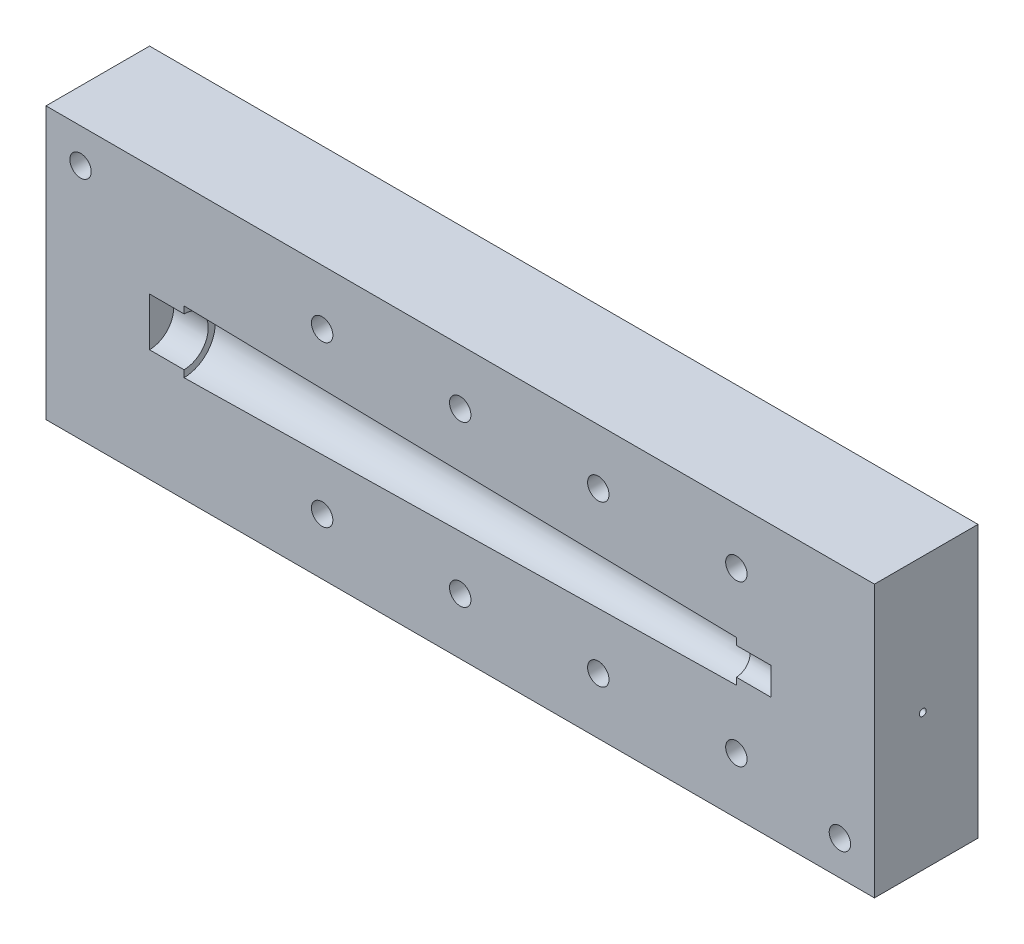
from build123d import *

# Parameters (mm, degrees)
SKIZZE2_W                        = 120
SKIZZE2_H                        = 39.364160046
AUFSATZ_LINEAR_AUSTRAGEN1_DEPTH  = 30
SKIZZE24_R                       = 1.55
SCHNITT_LINEAR_AUSTRAGEN4_DEPTH  = 130.805766806
SKIZZE46_R                       = 2.85
SCHNITT_LINEAR_AUSTRAGEN15_DEPTH = 10
SCHNITT_LINEAR_START             = -5
SCHNITT_LINEAR_AUSTRAGEN25_DEPTH = 2.7
LINEARES_MUSTER1_COUNT           = 4
LINEARES_MUSTER1_PITCH           = 20
SPIEGELN2_COPY_1_SKETCH_R        = 2.85
SPIEGELN2_COPY_1_DEPTH           = 10
SPIEGELN2_COPY_2_SKETCH_R        = 2.85
SPIEGELN2_COPY_2_DEPTH           = 10
SPIEGELN2_COPY_3_SKETCH_R        = 2.85
SPIEGELN2_COPY_3_DEPTH           = 10
SPIEGELN2_START                  = -5
SPIEGELN2_COPY_4_DEPTH           = 2.7
SPIEGELN2_COPY_5_DEPTH           = 2.7
SPIEGELN2_COPY_6_DEPTH           = 2.7
SKIZZE51_R                       = 1.55
SCHNITT_LINEAR_AUSTRAGEN26_DEPTH = 130.805766806
SKIZZE75_R                       = 0.75
SCHNITT_LINEAR_AUSTRAGEN28_DEPTH = 10
SKIZZE76_R                       = 2
SCHNITT_LINEAR_AUSTRAGEN29_DEPTH = 6
SKIZZE80_R                       = 0.5
SCHNITT_LINEAR_AUSTRAGEN34_DEPTH = 21
SCHNITT_LINEAR_START_2           = -7.5
SKIZZE81_R                       = 0.5
SCHNITT_LINEAR_AUSTRAGEN36_DEPTH = 5
ABSPALTEN3_START                 = 15
ABSPALTEN3_OUTLINE_W             = 120
ABSPALTEN3_OUTLINE_H             = 39.364160046
ABSPALTEN3_OUTLINE_R             = 1.55
ABSPALTEN3_DEPTH                 = 15


# Read off the part's stored shape, not the designer's step: Abspalten3
with BuildPart() as part:
    # Skizze2 → Aufsatz-Linear austragen1 (new body)
    with BuildSketch(Plane.XY):
        with Locations((60, 19.682080023)):
            Rectangle(SKIZZE2_W, SKIZZE2_H)
    extrude(amount=AUFSATZ_LINEAR_AUSTRAGEN1_DEPTH)

    # Skizze24 → Schnitt-Linear austragen4 (cut, through all)
    with BuildSketch(Plane.XY.offset(30)):
        with Locations((40, 31.364160046)):
            Circle(SKIZZE24_R)
        with Locations((60, 31.364160046)):
            Circle(SKIZZE24_R)
        with Locations((80, 31.364160046)):
            Circle(SKIZZE24_R)
        with Locations((100, 31.364160046)):
            Circle(SKIZZE24_R)
    schnitt_linear_austragen4 = extrude(amount=-SCHNITT_LINEAR_AUSTRAGEN4_DEPTH, mode=Mode.SUBTRACT)

    # Skizze46 → Schnitt-Linear austragen15 (cut)
    with BuildSketch(Plane(origin=(0, 0, 0), x_dir=(-1, 0, 0), z_dir=(0, 0, -1))):
        with Locations((-100, 31.364160046)):
            Circle(SKIZZE46_R)
    schnitt_linear_austragen15 = extrude(amount=-SCHNITT_LINEAR_AUSTRAGEN15_DEPTH, mode=Mode.SUBTRACT)

    # Skizze50 → Schnitt-Linear austragen25 (cut)
    with BuildSketch(Plane.XY.offset(30).offset(SCHNITT_LINEAR_START)):
        Polygon((97.15, 33.009608314), (97.15, 39.364160046), (102.85, 39.364160046), (102.85, 33.009608314), (102.85, 29.718711779), (100, 28.073263512), (97.15, 29.718711779), align=None)
    schnitt_linear_austragen25 = extrude(amount=-SCHNITT_LINEAR_AUSTRAGEN25_DEPTH, mode=Mode.SUBTRACT)

    # Lineares Muster1: Schnitt-Linear austragen15, Schnitt-Linear austragen25 ×4
    with Locations(*[(-i * LINEARES_MUSTER1_PITCH, 0, 0) for i in range(1, LINEARES_MUSTER1_COUNT)]):
        add(schnitt_linear_austragen15, mode=Mode.SUBTRACT)
        add(schnitt_linear_austragen25, mode=Mode.SUBTRACT)

    # Spiegeln2: Schnitt-Linear austragen15, Schnitt-Linear austragen25 across plane
    add(schnitt_linear_austragen15.mirror(Plane.ZX.offset(19.764160046)), mode=Mode.SUBTRACT)
    add(schnitt_linear_austragen25.mirror(Plane.ZX.offset(19.764160046)), mode=Mode.SUBTRACT)

    # Spiegeln2 copy 1 sketch → Spiegeln2 copy 1 (cut)
    with BuildSketch(Plane(origin=(-20, 39.528320093, 0), x_dir=(-1, 0, 0), z_dir=(0, 0, -1))):
        with Locations((-100, -31.364160046)):
            Circle(SPIEGELN2_COPY_1_SKETCH_R)
    extrude(amount=-SPIEGELN2_COPY_1_DEPTH, mode=Mode.SUBTRACT)

    # Spiegeln2 copy 2 sketch → Spiegeln2 copy 2 (cut)
    with BuildSketch(Plane(origin=(-40, 39.528320093, 0), x_dir=(-1, 0, 0), z_dir=(0, 0, -1))):
        with Locations((-100, -31.364160046)):
            Circle(SPIEGELN2_COPY_2_SKETCH_R)
    extrude(amount=-SPIEGELN2_COPY_2_DEPTH, mode=Mode.SUBTRACT)

    # Spiegeln2 copy 3 sketch → Spiegeln2 copy 3 (cut)
    with BuildSketch(Plane(origin=(-60, 39.528320093, 0), x_dir=(-1, 0, 0), z_dir=(0, 0, -1))):
        with Locations((-100, -31.364160046)):
            Circle(SPIEGELN2_COPY_3_SKETCH_R)
    extrude(amount=-SPIEGELN2_COPY_3_DEPTH, mode=Mode.SUBTRACT)

    # Spiegeln2 copy 4 sketch → Spiegeln2 copy 4 (cut)
    with BuildSketch(Plane(origin=(-20, 39.528320093, 30), x_dir=(1, 0, 0), z_dir=(0, 0, 1)).offset(SPIEGELN2_START)):
        Polygon((97.15, -33.009608314), (97.15, -39.364160046), (102.85, -39.364160046), (102.85, -33.009608314), (102.85, -29.718711779), (100, -28.073263512), (97.15, -29.718711779), align=None)
    extrude(amount=-SPIEGELN2_COPY_4_DEPTH, mode=Mode.SUBTRACT)

    # Spiegeln2 copy 5 sketch → Spiegeln2 copy 5 (cut)
    with BuildSketch(Plane(origin=(-40, 39.528320093, 30), x_dir=(1, 0, 0), z_dir=(0, 0, 1)).offset(SPIEGELN2_START)):
        Polygon((97.15, -33.009608314), (97.15, -39.364160046), (102.85, -39.364160046), (102.85, -33.009608314), (102.85, -29.718711779), (100, -28.073263512), (97.15, -29.718711779), align=None)
    extrude(amount=-SPIEGELN2_COPY_5_DEPTH, mode=Mode.SUBTRACT)

    # Spiegeln2 copy 6 sketch → Spiegeln2 copy 6 (cut)
    with BuildSketch(Plane(origin=(-60, 39.528320093, 30), x_dir=(1, 0, 0), z_dir=(0, 0, 1)).offset(SPIEGELN2_START)):
        Polygon((97.15, -33.009608314), (97.15, -39.364160046), (102.85, -39.364160046), (102.85, -33.009608314), (102.85, -29.718711779), (100, -28.073263512), (97.15, -29.718711779), align=None)
    extrude(amount=-SPIEGELN2_COPY_6_DEPTH, mode=Mode.SUBTRACT)

    # Spiegeln3: Schnitt-Linear austragen4 across plane
    add(schnitt_linear_austragen4.mirror(Plane.ZX.offset(19.764160046)), mode=Mode.SUBTRACT)

    # Skizze51 → Schnitt-Linear austragen26 (cut, through all)
    with BuildSketch(Plane.XY.offset(30)):
        with Locations((5, 34.364160046)):
            Circle(SKIZZE51_R)
        with Locations((115, 5)):
            Circle(SKIZZE51_R)
    extrude(amount=-SCHNITT_LINEAR_AUSTRAGEN26_DEPTH, mode=Mode.SUBTRACT)

    # Skizze73 → Schnitt-Rotation5 (revolve, cut)
    with BuildSketch(Plane.XY.offset(15)):
        Polygon((15, 19.764160046), (15, 23.264160046), (20, 23.264160046), (20, 24.264160046), (100, 22.682080023), (100, 21.682080023), (105, 21.682080023), (105, 19.682080023), align=None)
    revolve(axis=Axis((105, 19.682080023, 15), (-0.9999995841280241, 0.0009119998787298228, 0)), mode=Mode.SUBTRACT)

    # Skizze75 → Schnitt-Linear austragen28 (cut)
    with BuildSketch(Plane.XY.offset(30)):
        with Locations((21.598259807, 19.682080023)):
            Circle(SKIZZE75_R)
    extrude(amount=-SCHNITT_LINEAR_AUSTRAGEN28_DEPTH, mode=Mode.SUBTRACT)

    # Skizze76 → Schnitt-Linear austragen29 (cut)
    with BuildSketch(Plane.XY.offset(30)):
        with Locations((21.598259807, 19.682080023)):
            Circle(SKIZZE76_R)
    extrude(amount=-SCHNITT_LINEAR_AUSTRAGEN29_DEPTH, mode=Mode.SUBTRACT)

    # Skizze80 → Schnitt-Linear austragen34 (cut)
    with BuildSketch(Plane(origin=(120, 0, 0), x_dir=(0, 0, -1), z_dir=(1, 0, 0))):
        with Locations((-22.000416524, 19.763714623)):
            Circle(SKIZZE80_R)
    schnitt_linear_austragen34 = extrude(amount=-SCHNITT_LINEAR_AUSTRAGEN34_DEPTH, mode=Mode.SUBTRACT)

    # Skizze81 → Schnitt-Linear austragen36 (cut)
    with BuildSketch(Plane.XY.offset(30).offset(SCHNITT_LINEAR_START_2)):
        with Locations(Location((99, 19.682080023, 0), (0, 0, 7.034090001))):
            Circle(SKIZZE81_R)
    schnitt_linear_austragen36 = extrude(amount=-SCHNITT_LINEAR_AUSTRAGEN36_DEPTH, mode=Mode.SUBTRACT)

    # Spiegeln4: Schnitt-Linear austragen34, Schnitt-Linear austragen36 across plane
    add(schnitt_linear_austragen34.mirror(Plane.XY.offset(15)), mode=Mode.SUBTRACT)
    add(schnitt_linear_austragen36.mirror(Plane.XY.offset(15)), mode=Mode.SUBTRACT)

    # Abspalten3 outline → Abspalten3 (cut)
    with BuildSketch(Plane.XY.offset(ABSPALTEN3_START)):
        with Locations((60, 19.682080023)):
            Rectangle(ABSPALTEN3_OUTLINE_W, ABSPALTEN3_OUTLINE_H)
        with Locations((115, 5)):
            Circle(ABSPALTEN3_OUTLINE_R, mode=Mode.SUBTRACT)
        with Locations((5, 34.364160046)):
            Circle(ABSPALTEN3_OUTLINE_R, mode=Mode.SUBTRACT)
        with Locations((40, 31.364160046)):
            Circle(ABSPALTEN3_OUTLINE_R, mode=Mode.SUBTRACT)
        with Locations((60, 31.364160046)):
            Circle(ABSPALTEN3_OUTLINE_R, mode=Mode.SUBTRACT)
        with Locations((80, 31.364160046)):
            Circle(ABSPALTEN3_OUTLINE_R, mode=Mode.SUBTRACT)
        with Locations((100, 31.364160046)):
            Circle(ABSPALTEN3_OUTLINE_R, mode=Mode.SUBTRACT)
        with Locations((40, 8.164160046)):
            Circle(ABSPALTEN3_OUTLINE_R, mode=Mode.SUBTRACT)
        with Locations((60, 8.164160046)):
            Circle(ABSPALTEN3_OUTLINE_R, mode=Mode.SUBTRACT)
        with Locations((80, 8.164160046)):
            Circle(ABSPALTEN3_OUTLINE_R, mode=Mode.SUBTRACT)
        with Locations((100, 8.164160046)):
            Circle(ABSPALTEN3_OUTLINE_R, mode=Mode.SUBTRACT)
    extrude(amount=ABSPALTEN3_DEPTH, mode=Mode.SUBTRACT)


solid = part.part
